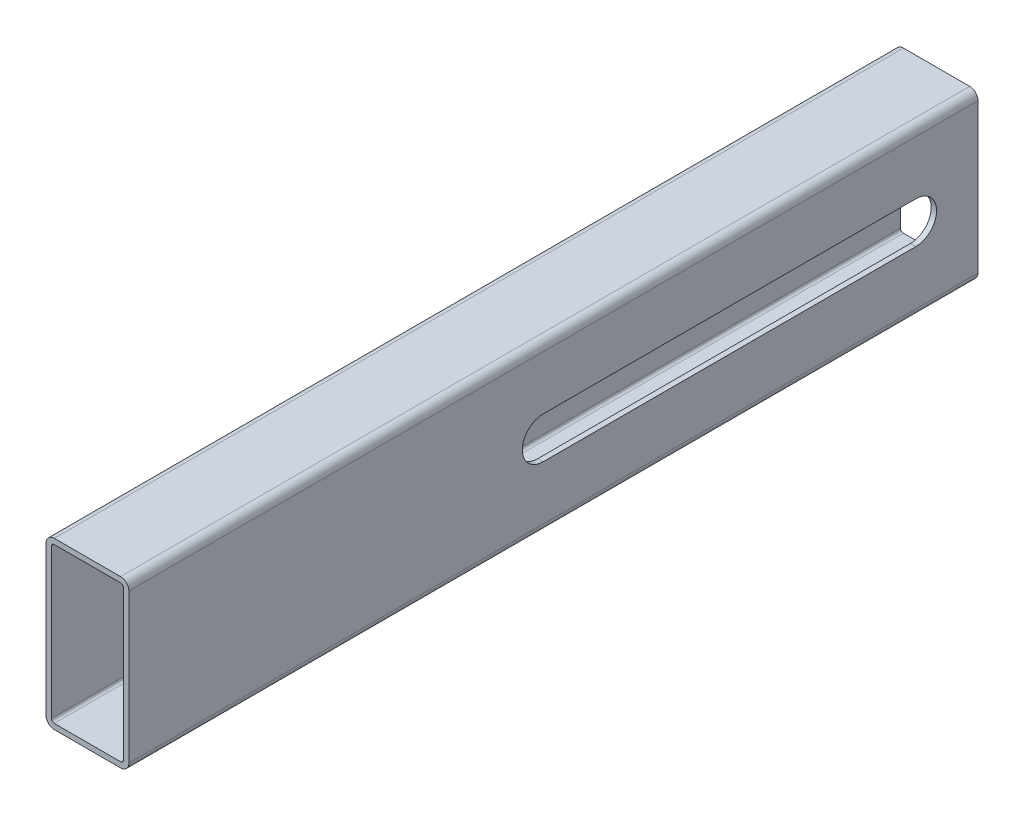
from build123d import *

# Parameters (mm, degrees)
EXTRUDE_THIN1_DEPTH = 260.35
CUT_EXTRUDE1_DEPTH  = 263.8163665


with BuildPart() as part:
    # Sketch1 → Extrude-Thin1 (new body)
    with BuildSketch(Plane.XY):
        with BuildLine():
            Line((-10.16, 25.4), (10.16, 25.4))
            ThreePointArc((10.16, 25.4), (11.956051224, 24.656051224), (12.7, 22.86))
            Line((12.7, 22.86), (12.7, -22.86))
            ThreePointArc((12.7, -22.86), (11.956051224, -24.656051224), (10.16, -25.4))
            Line((10.16, -25.4), (-10.16, -25.4))
            ThreePointArc((-10.16, -25.4), (-11.956051224, -24.656051224), (-12.7, -22.86))
            Line((-12.7, -22.86), (-12.7, 22.86))
            ThreePointArc((-12.7, 22.86), (-11.956051224, 24.656051224), (-10.16, 25.4))
        make_face()
        with BuildLine():
            Line((-10.16, 23.749), (10.16, 23.749))
            ThreePointArc((10.16, 23.749), (10.788617928, 23.488617928), (11.049, 22.86))
            Line((11.049, 22.86), (11.049, -22.86))
            ThreePointArc((11.049, -22.86), (10.788617928, -23.488617928), (10.16, -23.749))
            Line((10.16, -23.749), (-10.16, -23.749))
            ThreePointArc((-10.16, -23.749), (-10.788617928, -23.488617928), (-11.049, -22.86))
            Line((-11.049, -22.86), (-11.049, 22.86))
            ThreePointArc((-11.049, 22.86), (-10.788617928, 23.488617928), (-10.16, 23.749))
        make_face(mode=Mode.SUBTRACT)
    extrude(amount=EXTRUDE_THIN1_DEPTH)

    # Sketch2 → Cut-Extrude1 (cut, through all)
    with BuildSketch(Plane.ZY.offset(12.7)):
        with BuildLine():
            Line((19.05, 6.35), (133.35, 6.35))
            ThreePointArc((133.35, 6.35), (139.7, 0), (133.35, -6.35))
            Line((133.35, -6.35), (19.05, -6.35))
            ThreePointArc((19.05, -6.35), (12.7, 0), (19.05, 6.35))
        make_face()
    extrude(amount=-CUT_EXTRUDE1_DEPTH, mode=Mode.SUBTRACT)


solid = part.part
